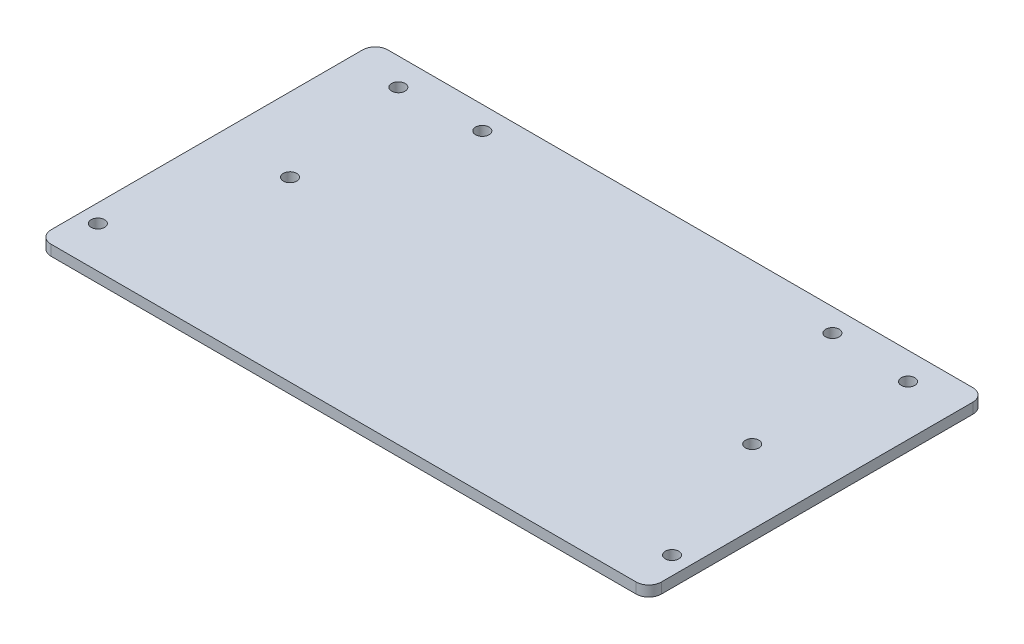
from build123d import *

# Parameters (mm, degrees)
SKETCH1_W           = 184.15
SKETCH1_H           = 101.6
BOSS_EXTRUDE1_DEPTH = 3.175
FILLET1_R           = 3.81
SKETCH2_R           = 2.032
CUT_EXTRUDE1_DEPTH  = 211.342252353


with BuildPart() as part:
    # Sketch1 → Boss-Extrude1 (new body)
    with BuildSketch(Plane(origin=(0, 0, 0), x_dir=(1, 0, 0), z_dir=(0, 1, 0))):
        with Locations((92.075, -50.8)):
            Rectangle(SKETCH1_W, SKETCH1_H)
    extrude(amount=BOSS_EXTRUDE1_DEPTH)

    # Fillet1
    fillet1_edges = [part.edges().sort_by_distance(p)[0] for p in [
        (184.15, 1.5875, 0),
        (184.15, 1.5875, 101.6),
        (0, 1.5875, 0),
        (0, 1.5875, 101.6),
    ]]
    fillet(fillet1_edges, radius=FILLET1_R)

    # Sketch2 → Cut-Extrude1 (cut, through all)
    with BuildSketch(Plane(origin=(0, 3.175, 0), x_dir=(1, 0, 0), z_dir=(0, 1, 0))):
        with Locations((5.437401114, -89.146320086)):
            Circle(SKETCH2_R)
        with Locations((22.338907609, -48.03498858)):
            Circle(SKETCH2_R)
        with Locations((39.240414104, -6.923657075)):
            Circle(SKETCH2_R)
        with Locations((15.16630044, -8.195189781)):
            Circle(SKETCH2_R)
        with Locations((178.712598886, -89.146320086)):
            Circle(SKETCH2_R)
        with Locations((161.811092391, -48.03498858)):
            Circle(SKETCH2_R)
        with Locations((168.98369956, -8.195189781)):
            Circle(SKETCH2_R)
        with Locations((144.909585896, -6.923657075)):
            Circle(SKETCH2_R)
    extrude(amount=-CUT_EXTRUDE1_DEPTH, mode=Mode.SUBTRACT)


solid = part.part
